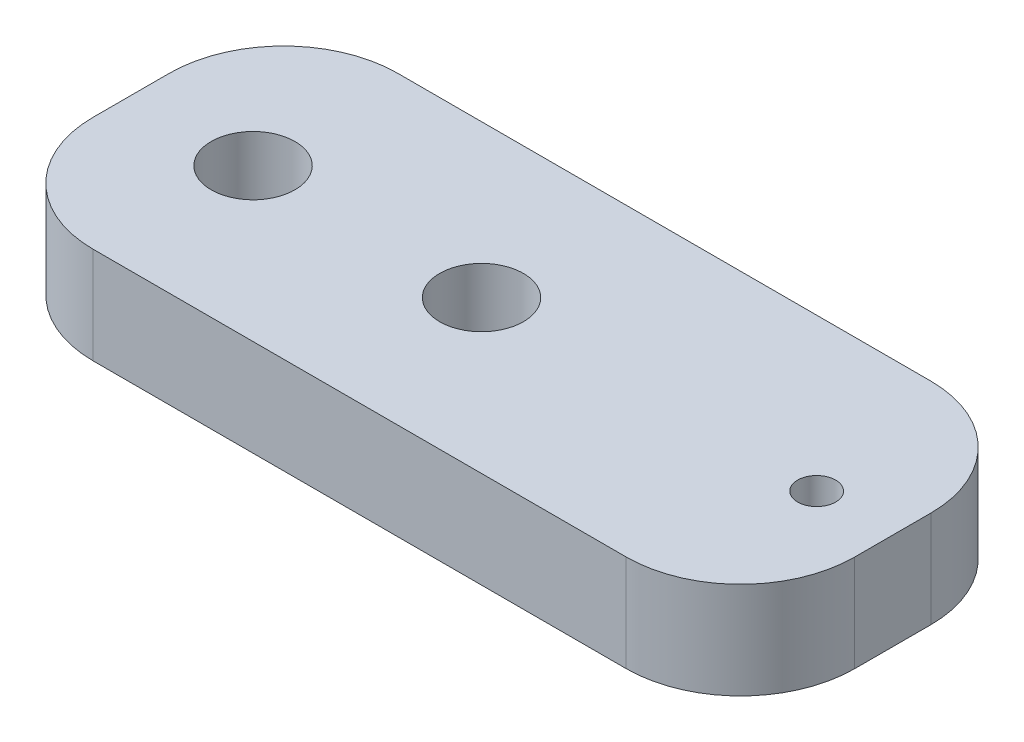
from build123d import *

# Parameters (mm, degrees)
SKETCH2_W                       = 50
SKETCH2_H                       = 20
BOSS_EXTRUDE1_DEPTH             = 6.35
M5_CLEARANCE_HOLE1_D            = 5.5
TAP_DRILL_FOR_M3X0_5_TAP1_D     = 2.5
TAP_DRILL_FOR_M3X0_5_TAP1_DEPTH = 6.35
TAP_DRILL_FOR_M3X0_5_TAP1_TIP   = 0.751075774
FILLET1_R                       = 7.5


with BuildPart() as part:
    # Sketch2 → Boss-Extrude1 (new body)
    with BuildSketch(Plane(origin=(0, 0, 0), x_dir=(1, 0, 0), z_dir=(0, 1, 0))):
        with Locations((25, 10)):
            Rectangle(SKETCH2_W, SKETCH2_H)
    extrude(amount=BOSS_EXTRUDE1_DEPTH)

    # M5 Clearance Hole1 (through all)
    with Locations(Plane(origin=(8, 6.35, -10), x_dir=(0, 0, 1), z_dir=(0, 1, 0))):
        with Locations((0, 0), (0, 15)):
            Hole(M5_CLEARANCE_HOLE1_D / 2)

    # Tap Drill for M3x0.5 Tap1
    with Locations(Plane(origin=(45, 6.35, -10), x_dir=(0, 0, 1), z_dir=(0, 1, 0))):
        with Locations((0, 0)):
            Hole(TAP_DRILL_FOR_M3X0_5_TAP1_D / 2, depth=TAP_DRILL_FOR_M3X0_5_TAP1_DEPTH)
            with Locations((0, 0, -(TAP_DRILL_FOR_M3X0_5_TAP1_DEPTH + TAP_DRILL_FOR_M3X0_5_TAP1_TIP / 2))):  # 118° drill point
                Cone(0, TAP_DRILL_FOR_M3X0_5_TAP1_D / 2, TAP_DRILL_FOR_M3X0_5_TAP1_TIP, mode=Mode.SUBTRACT)

    # Fillet1
    fillet1_edges = [part.edges().sort_by_distance(p)[0] for p in [
        (50, 3.175, 0),
        (50, 3.175, -20),
        (0, 3.175, -20),
        (0, 3.175, 0),
    ]]
    fillet(fillet1_edges, radius=FILLET1_R)


solid = part.part
